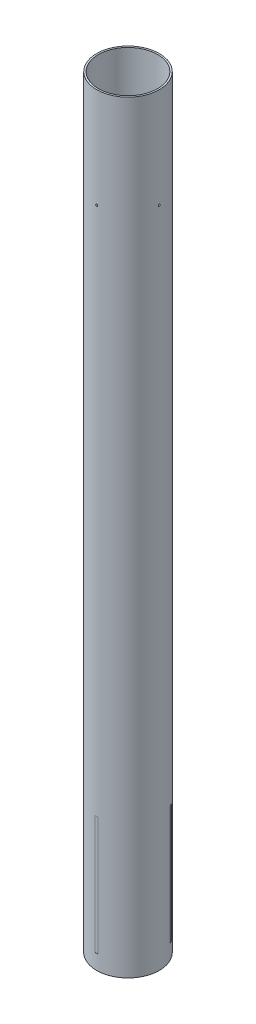
from build123d import *

# Parameters (mm, degrees)
SKETCH1_R               = 53.721
SKETCH1_R_2             = 50.8
TUBE_EXTRUSION_DEPTH    = 1308.1
ENGINE_BLOCK_HOLE_REACH = 1315.604
SKETCH2_R               = 1.6383
CIRPATTERN1_COUNT       = 4
SKETCH3_W               = 5.334
SKETCH3_H               = 203.2
FIN_SLOTS_DEPTH         = 0.254
CIRPATTERN2_COUNT       = 3


with BuildPart() as part:
    # Sketch1 → Tube Extrusion (new body)
    with BuildSketch(Plane(origin=(0, 0, 0), x_dir=(1, 0, 0), z_dir=(0, 1, 0))):
        Circle(SKETCH1_R)
        Circle(SKETCH1_R_2, mode=Mode.SUBTRACT)
    extrude(amount=TUBE_EXTRUSION_DEPTH)

    # Sketch2 → Engine Block Hole (cut, up to next)
    with BuildSketch(Plane.XY.offset(53.721), mode=Mode.PRIVATE) as engine_block_hole_sk1:
        with Locations((0, 1136.65)):
            Circle(SKETCH2_R)
    engine_block_hole_tool1 = extrude(engine_block_hole_sk1.sketch, amount=-ENGINE_BLOCK_HOLE_REACH, mode=Mode.PRIVATE) & part.part
    engine_block_hole = engine_block_hole_tool1.solids().sort_by_distance((0, 1136.65, 53.721))[0]
    add(engine_block_hole, mode=Mode.SUBTRACT)

    # CirPattern1: Engine Block Hole ×4 about axis
    cirpattern1_axis = Axis((0, 1308.1, 0), (0, -1, 0))
    for i in range(1, CIRPATTERN1_COUNT):
        add(engine_block_hole.rotate(cirpattern1_axis, i * 360 / CIRPATTERN1_COUNT), mode=Mode.SUBTRACT)

    # Sketch3 → Fin Slots (cut)
    with BuildSketch(Plane.XY.offset(53.721)):
        with Locations((0, 127)):
            Rectangle(SKETCH3_W, SKETCH3_H)
    fin_slots = extrude(amount=-FIN_SLOTS_DEPTH, mode=Mode.SUBTRACT)

    # CirPattern2: Fin Slots ×3 about axis
    cirpattern2_axis = Axis((0, 1308.1, 0), (0, -1, 0))
    for i in range(1, CIRPATTERN2_COUNT):
        add(fin_slots.rotate(cirpattern2_axis, i * 360 / CIRPATTERN2_COUNT), mode=Mode.SUBTRACT)


solid = part.part
